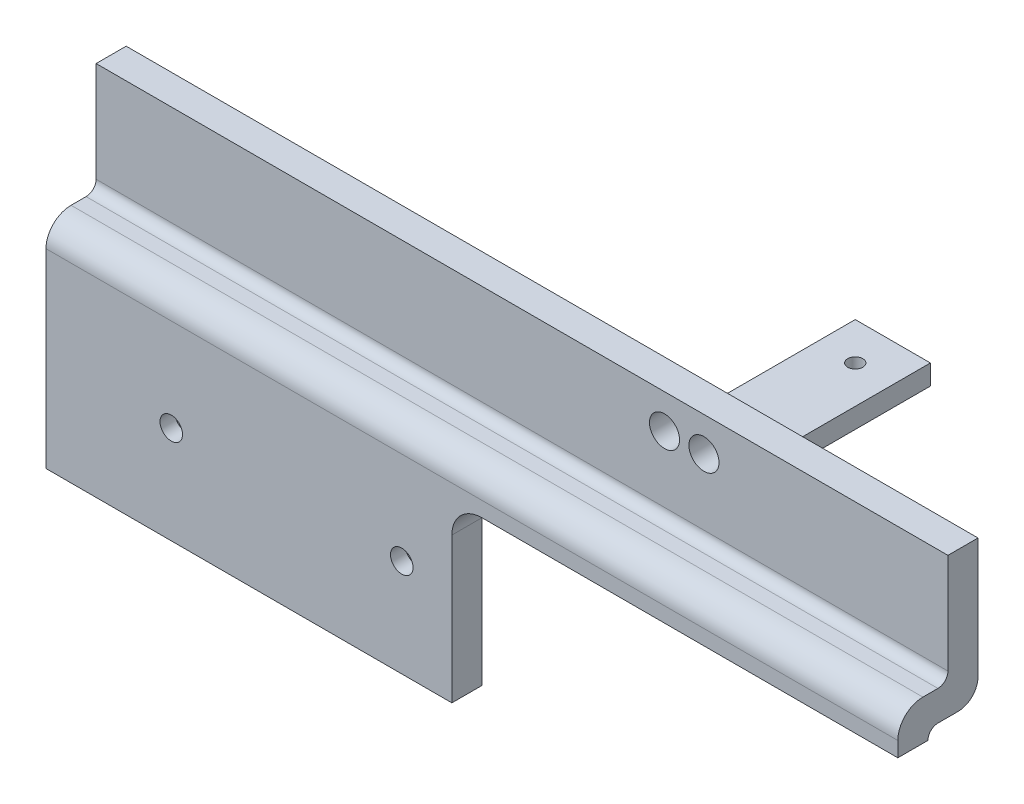
from build123d import *

# Parameters (mm, degrees)
ESTRUSIONE_ESTRUSIONE1_DEPTH                         = 170
FORO_LAMATO_PER_BULLONE_M5_A_TESTA_ESAGO_D           = 4.5
FORO_LAMATO_PER_BULLONE_M5_A_TESTA_ESAGO_DEPTH       = 30
FORO_LAMATO_PER_BULLONE_M5_A_TESTA_ESAGO_CBORE_D     = 10
FORO_LAMATO_PER_BULLONE_M5_A_TESTA_ESAGO_CBORE_DEPTH = 3
FORO_LAMATO_PER_BULLONE_M5_A_TESTA_ESAGO_TIP         = 1.351936393
SCHIZZO4_W                                           = 89
SCHIZZO4_H                                           = 35
TAGLIO_ESTRUSIONE1_DEPTH                             = 170
RACCORDO1_R                                          = 6
SCHIZZO5_W                                           = 15
SCHIZZO5_H                                           = 4
ESTRUSIONE_ESTRUSIONE2_DEPTH                         = 35.5
SCHIZZO6_R                                           = 1.5
TAGLIO_ESTRUSIONE2_DEPTH                             = 32
SCHIZZO7_R                                           = 3
TAGLIO_ESTRUSIONE3_DEPTH                             = 10
SMUSSO1_SIZE                                         = 10
SMUSSO2_SIZE                                         = 2


with BuildPart() as part:
    # Schizzo1 → Estrusione-Estrusione1 (new body)
    with BuildSketch(Plane(origin=(0, 0, 0), x_dir=(0, 0, -1), z_dir=(1, 0, 0))):
        with BuildLine():
            Line((0, 0), (6, 0))
            Line((6, 0), (6, 35))
            ThreePointArc((6, 35), (6.585786438, 36.414213562), (8, 37))
            Line((8, 37), (12, 37))
            ThreePointArc((12, 37), (14.828427125, 38.171572875), (16, 41))
            Line((16, 41), (16, 65))
            Line((16, 65), (10, 65))
            Line((10, 65), (10, 45))
            ThreePointArc((10, 45), (9.414213562, 43.585786438), (8, 43))
            Line((8, 43), (5, 43))
            ThreePointArc((5, 43), (1.464466094, 41.535533906), (0, 38))
            Line((0, 38), (0, 0))
        make_face()
    extrude(amount=ESTRUSIONE_ESTRUSIONE1_DEPTH)

    # Foro lamato per Bullone M5 a testa esagonale-1
    with Locations(Plane(origin=(0, 0, -6), x_dir=(-1, 0, 0), z_dir=(0, 0, -1))):
        with Locations((-25, 19.5), (-71, 19.5)):
            CounterBoreHole(FORO_LAMATO_PER_BULLONE_M5_A_TESTA_ESAGO_D / 2, FORO_LAMATO_PER_BULLONE_M5_A_TESTA_ESAGO_CBORE_D / 2, FORO_LAMATO_PER_BULLONE_M5_A_TESTA_ESAGO_CBORE_DEPTH, depth=FORO_LAMATO_PER_BULLONE_M5_A_TESTA_ESAGO_DEPTH)
            with Locations((0, 0, -(FORO_LAMATO_PER_BULLONE_M5_A_TESTA_ESAGO_DEPTH + FORO_LAMATO_PER_BULLONE_M5_A_TESTA_ESAGO_TIP / 2))):  # 118° drill point
                Cone(0, FORO_LAMATO_PER_BULLONE_M5_A_TESTA_ESAGO_D / 2, FORO_LAMATO_PER_BULLONE_M5_A_TESTA_ESAGO_TIP, mode=Mode.SUBTRACT)

    # Schizzo4 → Taglio-Estrusione1 (cut)
    with BuildSketch(Plane(origin=(0, 0, -6), x_dir=(-1, 0, 0), z_dir=(0, 0, -1))):
        with Locations((-125.5, 17.5)):
            Rectangle(SCHIZZO4_W, SCHIZZO4_H)
    extrude(amount=-TAGLIO_ESTRUSIONE1_DEPTH, mode=Mode.SUBTRACT)

    # Raccordo1
    raccordo1_edges = [part.edges().sort_by_distance(p)[0] for p in [
        (81, 35, -3),
    ]]
    fillet(raccordo1_edges, radius=RACCORDO1_R)

    # Schizzo5 → Estrusione-Estrusione2 (add)
    with BuildSketch(Plane(origin=(0, 0, -16), x_dir=(-1, 0, 0), z_dir=(0, 0, -1))):
        with Locations((-117.5, 53)):
            Rectangle(SCHIZZO5_W, SCHIZZO5_H)
    extrude(amount=ESTRUSIONE_ESTRUSIONE2_DEPTH)

    # Schizzo6 → Taglio-Estrusione2 (cut)
    with BuildSketch(Plane(origin=(0, 55, 0), x_dir=(1, 0, 0), z_dir=(0, 1, 0))):
        with Locations(Location((117.5, 44, 0), (0, 0, 270))):
            Circle(SCHIZZO6_R)
    extrude(amount=-TAGLIO_ESTRUSIONE2_DEPTH, mode=Mode.SUBTRACT)

    # Schizzo7 → Taglio-Estrusione3 (cut)
    with BuildSketch(Plane(origin=(0, 0, -16), x_dir=(-1, 0, 0), z_dir=(0, 0, -1))):
        with Locations((-121.31, 58.175)):
            Circle(SCHIZZO7_R)
        with Locations((-113.436, 58.175)):
            Circle(SCHIZZO7_R)
    extrude(amount=-TAGLIO_ESTRUSIONE3_DEPTH, mode=Mode.SUBTRACT)

    # Smusso1
    smusso1_edges = [part.edges().sort_by_distance(p)[0] for p in [
        (117.5, 51, -16),
    ]]
    chamfer(smusso1_edges, length=SMUSSO1_SIZE - 0.0001)  # a hair under: the kernel refuses the full size

    # Smusso2
    smusso2_edges = [part.edges().sort_by_distance(p)[0] for p in [
        (110, 48.00005, -16),
        (125, 48.00005, -16),
    ]]
    chamfer(smusso2_edges, length=SMUSSO2_SIZE)


solid = part.part
